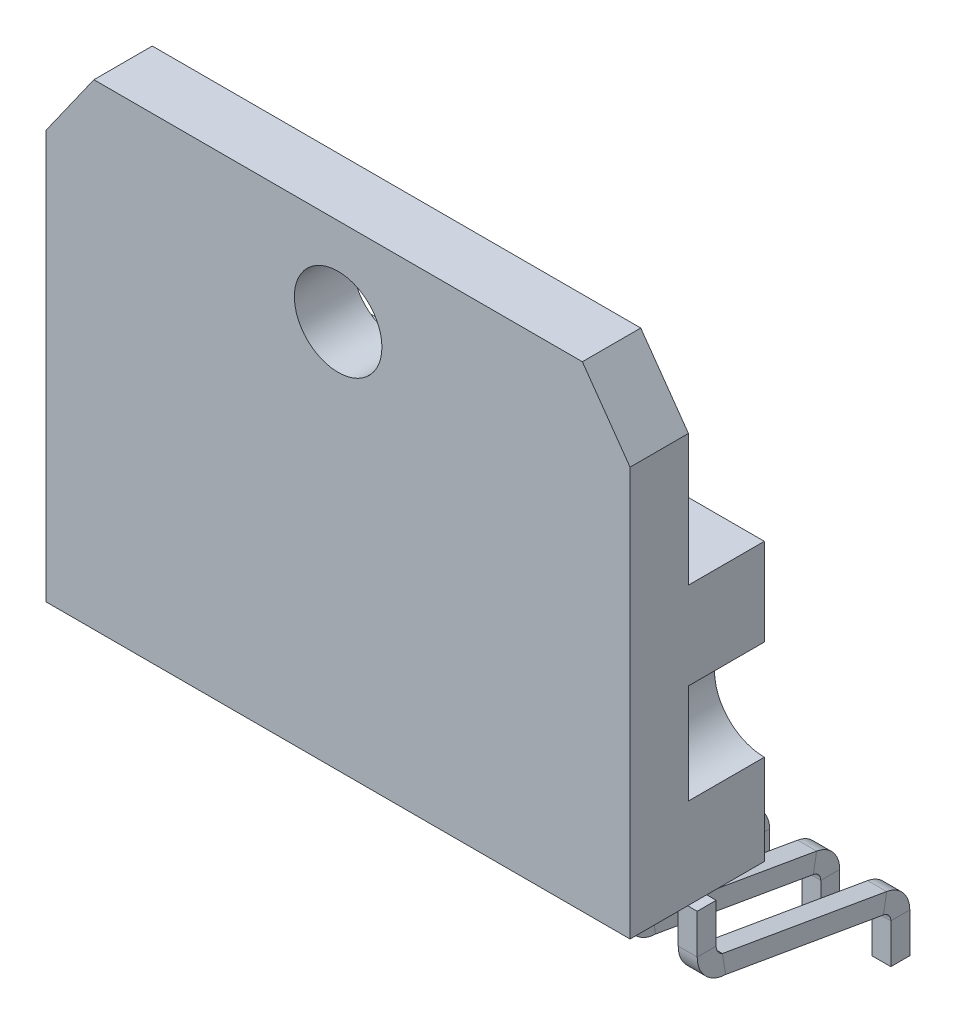
from build123d import *

# Parameters (mm, degrees)
SKETCH1_W           = 20
SKETCH1_H           = 9.5
BOSS_EXTRUDE1_DEPTH = 2
SKETCH2_W           = 20
SKETCH2_H           = 9.5
BOSS_EXTRUDE2_DEPTH = 2.6
SWEEP1_START        = 19.675
SWEEP1_DEPTH        = 0.65
LPATTERN1_COUNT     = 9
LPATTERN1_PITCH     = 2.4
SKETCH7_R           = 1.707304267
CUT_EXTRUDE1_DEPTH  = 7


# Read off the part's stored shape, not the designer's step: Sweep1
with BuildPart() as part:
    # Sketch1 → Boss-Extrude1 (new body)
    # profile 1 of 2: a face of its own
    with BuildSketch(Plane.XY):
        Polygon((0, 4.5), (0, 0), (20, 0), (20, 4.5), (18.366197365, 6.81075506), (10, 6.81075506), (1.633802635, 6.81075506), align=None)
        with BuildLine():
            ThreePointArc((11.5, 3.81075506), (8.939339828, 2.750094889), (10, 5.31075506))
            ThreePointArc((10, 5.31075506), (11.060660172, 4.871415232), (11.5, 3.81075506))
        make_face(mode=Mode.SUBTRACT)
    # profile 2 of 2: a face of its own
    with BuildSketch(Plane.XY):
        with Locations((10, -4.75)):
            Rectangle(SKETCH1_W, SKETCH1_H)
    extrude(amount=BOSS_EXTRUDE1_DEPTH)

    # Sketch2 → Boss-Extrude2 (add)
    with BuildSketch(Plane.XY):
        with Locations((10, -4.75)):
            Rectangle(SKETCH2_W, SKETCH2_H)
    extrude(amount=-BOSS_EXTRUDE2_DEPTH)

    # Sweep1 outline → Sweep1 (add)
    with BuildSketch(Plane.YZ.offset(SWEEP1_START)):
        with BuildLine():
            add(Edge.make_bspline(
                [(-11.185730745, -0.838846448), (-11.167727141, -0.797313688), (-11.141734544, -0.759335476), (-11.043550805, -0.662255571), (-10.952371553, -0.625), (-10.86, -0.625)],
                knots=[0.88697322, 0.88697322, 0.88697322, 0.88697322, 0.993985092, 0.993985092, 1.213935515, 1.213935515, 1.213935515, 1.213935515], degree=3))
            Line((-10.86, -0.625), (-9.5, -0.625))
            Line((-9.5, -0.625), (-9.5, 0.025))
            Line((-9.5, 0.025), (-10.86, 0.025))
            ThreePointArc((-10.86, 0.025), (-11.559733522, -0.258613835), (-11.864533496, -0.949382092))
            Line((-11.864533496, -0.949382092), (-12.800237008, -6.354563022))
            ThreePointArc((-12.800237008, -6.354563022), (-12.904352726, -6.535875042), (-13.100767124, -6.607537551))
            Line((-13.100767124, -6.607537551), (-14.460767124, -6.607537551))
            Line((-14.460767124, -6.607537551), (-14.460767124, -7.257537551))
            Line((-14.460767124, -7.257537551), (-13.100767124, -7.257537551))
            ThreePointArc((-13.100767124, -7.257537551), (-12.485764666, -7.03315166), (-12.159762992, -6.465436978))
            Line((-12.159762992, -6.465436978), (-11.185730745, -0.838846448))
        make_face()
    sweep1 = extrude(amount=SWEEP1_DEPTH)

    # LPattern1: Sweep1 ×9
    with Locations(*[(-i * LPATTERN1_PITCH, 0, 0) for i in range(1, LPATTERN1_COUNT)]):
        add(sweep1)

    # Sketch7 → Cut-Extrude1 (cut)
    with BuildSketch(Plane.XY):
        with Locations((0, -4.697252299)):
            Circle(SKETCH7_R)
        with Locations((20, -4.697252299)):
            Circle(SKETCH7_R)
    extrude(amount=-CUT_EXTRUDE1_DEPTH, mode=Mode.SUBTRACT)


solid = part.part
